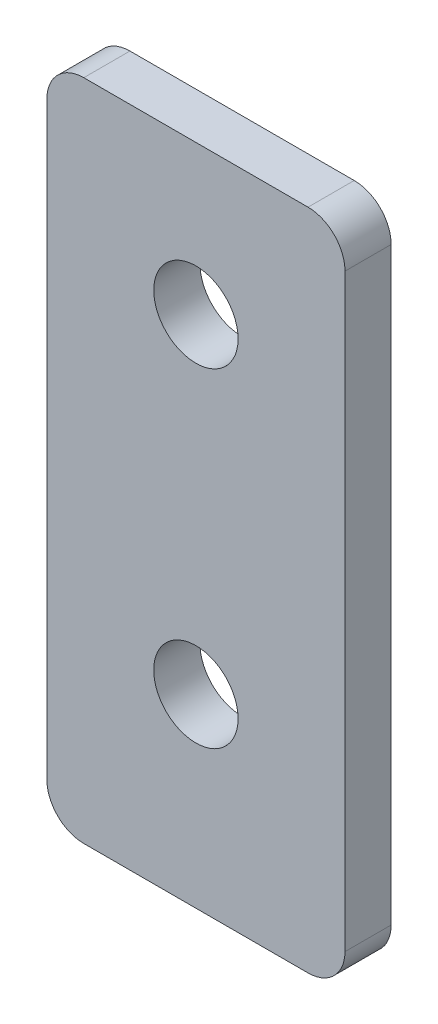
from build123d import *

# Parameters (mm, degrees)
SKETCH1_W            = 20.4978
SKETCH1_H            = 45.599133257
SKETCH1_R            = 0.890894817
SKETCH1_R_2          = 0.963661062
BOSS_EXTRUDE1_DEPTH  = 3.175
M5_CLEARANCE_HOLE3_D = 5.8
FILLET1_R            = 2.54
M5_CLEARANCE_HOLE1_D = 5.8


with BuildPart() as part:
    # Sketch1 → Boss-Extrude1 (new body)
    with BuildSketch(Plane.XY):
        with Locations((19.037900458, -1.288082074)):
            Rectangle(SKETCH1_W, SKETCH1_H)
        with Locations((19.037900458, -11.349548702)):
            Circle(SKETCH1_R, mode=Mode.SUBTRACT)
        with Locations((19.037900458, 11.262584555)):
            Circle(SKETCH1_R_2, mode=Mode.SUBTRACT)
    extrude(amount=BOSS_EXTRUDE1_DEPTH)

    # M5 Clearance Hole3 (through all)
    with Locations(Plane.XY.offset(3.175)):
        with Locations((19.037900458, 11.262584555)):
            Hole(M5_CLEARANCE_HOLE3_D / 2)

    # Fillet1
    fillet1_edges = [part.edges().sort_by_distance(p)[0] for p in [
        (29.286800458, 21.511484555, 1.5875),
        (29.286800458, -24.087648702, 1.5875),
        (8.789000458, -24.087648702, 1.5875),
        (8.789000458, 21.511484555, 1.5875),
    ]]
    fillet(fillet1_edges, radius=FILLET1_R)

    # M5 Clearance Hole1 (through all)
    with Locations(Plane.XY.offset(3.175)):
        with Locations((19.037900458, -11.349548702)):
            Hole(M5_CLEARANCE_HOLE1_D / 2)


solid = part.part
